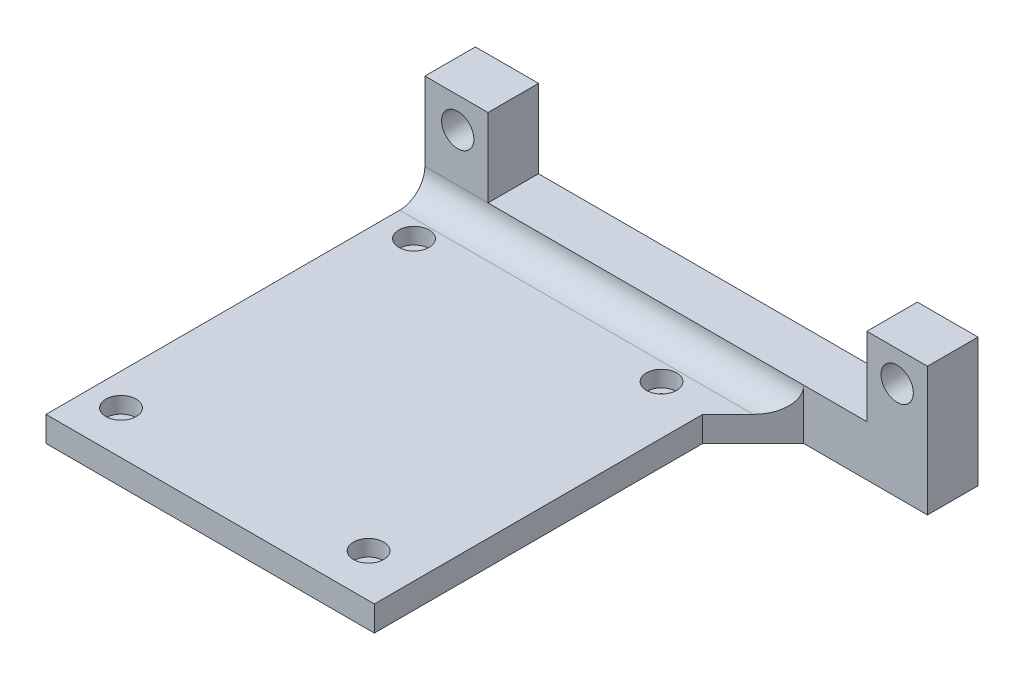
from build123d import *

# Parameters (mm, degrees)
SKETCH1_R               = 3.2
BOSS_EXTRUDE1_DEPTH     = 10
SKETCH2_W               = 65
SKETCH2_H               = 5
BOSS_EXTRUDE2_DEPTH     = 75
SKETCH4_R               = 3
BOSS_EXTRUDE3_DEPTH     = 3
CUT_EXTRUDE1_REACH      = 137.125
CUT_EXTRUDE1_START      = -1.8
SKETCH4_2_R             = 3
CUT_EXTRUDE2_DEPTH      = 134.324791393
CUT_EXTRUDE2_DEPTH_BACK = 134.324791393
SKETCH3_R               = 1.6
FILLET1_R               = 5
CHAMFER1_SIZE           = 10
FILLET2_R               = 1.5


with BuildPart() as part:
    # Sketch1 → Boss-Extrude1 (new body)
    with BuildSketch(Plane.XY):
        Polygon((99.5, 12.5), (87.5, 12.5), (87.5, -3), (12.5, -3), (12.5, 12.5), (0, 12.5), (0, -13), (99.5, -13), align=None)
        with Locations((93.5, 6.5)):
            Circle(SKETCH1_R, mode=Mode.SUBTRACT)
        with Locations((6.5, 6.5)):
            Circle(SKETCH1_R, mode=Mode.SUBTRACT)
    extrude(amount=BOSS_EXTRUDE1_DEPTH)

    # Sketch2 → Boss-Extrude2 (add)
    with BuildSketch(Plane.XY.offset(10)):
        with Locations((32.5, -10.5)):
            Rectangle(SKETCH2_W, SKETCH2_H)
    extrude(amount=BOSS_EXTRUDE2_DEPTH)

    # Sketch4 → Boss-Extrude3 (add)
    with BuildSketch(Plane.XZ.offset(13)):
        with Locations(Location((6.31000124, 76.457704619, 0), (0, 0, 180))):
            Circle(SKETCH4_R)
        with Locations(Location((55.31000124, 76.457704619, 0), (0, 0, 180))):
            Circle(SKETCH4_R)
        with Locations(Location((55.31000124, 18.457704619, 0), (0, 0, 180))):
            Circle(SKETCH4_R)
        with Locations(Location((6.31000124, 18.457704619, 0), (0, 0, 180))):
            Circle(SKETCH4_R)
    extrude(amount=BOSS_EXTRUDE3_DEPTH)

    # Sketch4<2> → Cut-Extrude1 (cut, up to next)
    with BuildSketch(Plane.XZ.offset(13).offset(CUT_EXTRUDE1_START), mode=Mode.PRIVATE) as cut_extrude1_sk1:
        with Locations(Location((6.31000124, 76.457704619, 0), (0, 0, 180))):
            Circle(SKETCH4_2_R)
    cut_extrude1_tool1 = extrude(cut_extrude1_sk1.sketch, amount=-CUT_EXTRUDE1_REACH, mode=Mode.PRIVATE) & part.part
    # Sketch4<2> → Cut-Extrude1 (cut, up to next)
    with BuildSketch(Plane.XZ.offset(13).offset(CUT_EXTRUDE1_START), mode=Mode.PRIVATE) as cut_extrude1_sk2:
        with Locations(Location((55.31000124, 76.457704619, 0), (0, 0, 180))):
            Circle(SKETCH4_2_R)
    cut_extrude1_tool2 = extrude(cut_extrude1_sk2.sketch, amount=-CUT_EXTRUDE1_REACH, mode=Mode.PRIVATE) & part.part
    # Sketch4<2> → Cut-Extrude1 (cut, up to next)
    with BuildSketch(Plane.XZ.offset(13).offset(CUT_EXTRUDE1_START), mode=Mode.PRIVATE) as cut_extrude1_sk3:
        with Locations(Location((55.31000124, 18.457704619, 0), (0, 0, 180))):
            Circle(SKETCH4_2_R)
    cut_extrude1_tool3 = extrude(cut_extrude1_sk3.sketch, amount=-CUT_EXTRUDE1_REACH, mode=Mode.PRIVATE) & part.part
    # Sketch4<2> → Cut-Extrude1 (cut, up to next)
    with BuildSketch(Plane.XZ.offset(13).offset(CUT_EXTRUDE1_START), mode=Mode.PRIVATE) as cut_extrude1_sk4:
        with Locations(Location((6.31000124, 18.457704619, 0), (0, 0, 180))):
            Circle(SKETCH4_2_R)
    cut_extrude1_tool4 = extrude(cut_extrude1_sk4.sketch, amount=-CUT_EXTRUDE1_REACH, mode=Mode.PRIVATE) & part.part
    add(cut_extrude1_tool1.solids().sort_by_distance((6.310001, -11.2, 76.457705))[0], mode=Mode.SUBTRACT)
    add(cut_extrude1_tool2.solids().sort_by_distance((55.310001, -11.2, 76.457705))[0], mode=Mode.SUBTRACT)
    add(cut_extrude1_tool3.solids().sort_by_distance((55.310001, -11.2, 18.457705))[0], mode=Mode.SUBTRACT)
    add(cut_extrude1_tool4.solids().sort_by_distance((6.310001, -11.2, 18.457705))[0], mode=Mode.SUBTRACT)

    # Sketch3 → Cut-Extrude2 (cut, two sides: drawn at the far end of the back side and taken through both)
    with BuildSketch(Plane.XZ.offset(13).offset(-CUT_EXTRUDE2_DEPTH_BACK)):
        with Locations((6.31000124, 76.457704619)):
            Circle(SKETCH3_R)
        with Locations((55.31000124, 76.457704619)):
            Circle(SKETCH3_R)
        with Locations((6.31000124, 18.457704619)):
            Circle(SKETCH3_R)
        with Locations((55.31000124, 18.457704619)):
            Circle(SKETCH3_R)
    extrude(amount=CUT_EXTRUDE2_DEPTH + CUT_EXTRUDE2_DEPTH_BACK, mode=Mode.SUBTRACT)

    # Fillet1
    fillet1_edges = [part.edges().sort_by_distance(p)[0] for p in [
        (32.5, -8, 10),
    ]]
    fillet(fillet1_edges, radius=FILLET1_R - 0.0001)  # a hair under: the kernel refuses the full size

    # Chamfer1
    chamfer1_edges = [part.edges().sort_by_distance(p)[0] for p in [
        (65, -8.00005, 10),
    ]]
    chamfer(chamfer1_edges, length=CHAMFER1_SIZE)

    # Fillet2
    fillet2_edges = [part.edges().sort_by_distance(p)[0] for p in [
        (9.31000124, -13, 76.457704619),
        (58.31000124, -13, 76.457704619),
        (58.31000124, -13, 18.457704619),
        (9.31000124, -13, 18.457704619),
    ]]
    fillet(fillet2_edges, radius=FILLET2_R)


solid = part.part
